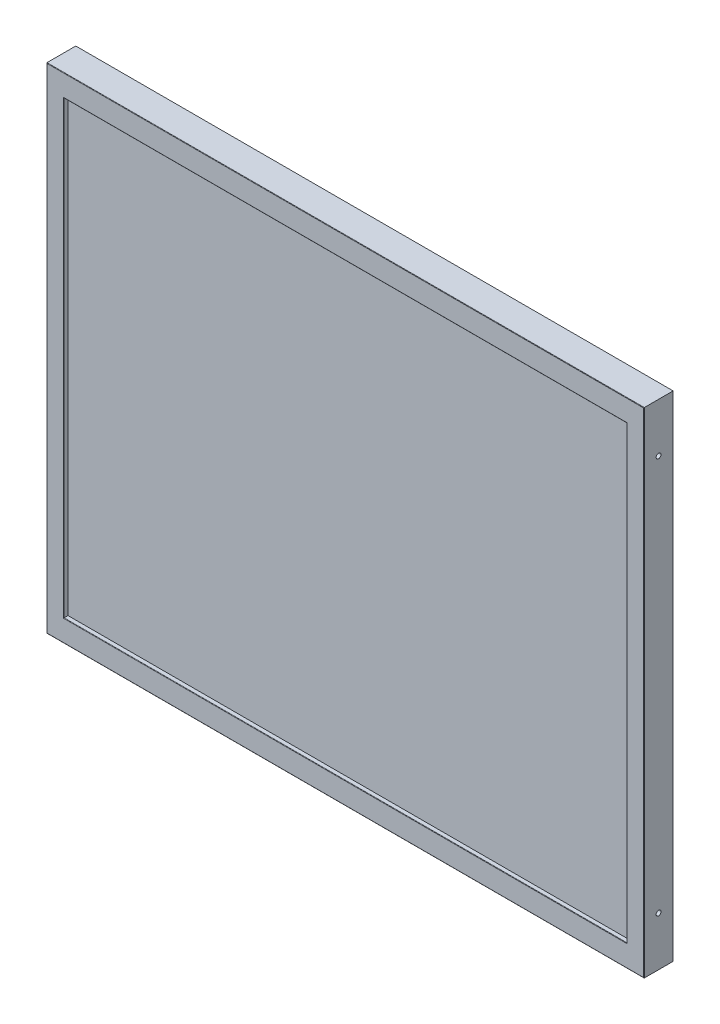
from build123d import *

# Parameters (mm, degrees)
SKETCH1_W           = 358.4999942
SKETCH1_H           = 296.4999912
BOSS_EXTRUDE1_DEPTH = 17.50000056
SKETCH2_W           = 337.90001
SKETCH2_H           = 270.2999928
CUT_EXTRUDE1_DEPTH  = 2.54
FILLET1_R           = 0.254
FILLET2_R           = 0.254
SKETCH3_R           = 1.4605
CUT_EXTRUDE2_DEPTH  = 5.08
CUT_EXTRUDE3_START  = -5.08
SKETCH4_R           = 1.4605
CUT_EXTRUDE3_DEPTH  = 5.08


with BuildPart() as part:
    # Sketch1 → Boss-Extrude1 (new body)
    with BuildSketch(Plane.XY):
        with Locations((179.2499971, 148.2499956)):
            Rectangle(SKETCH1_W, SKETCH1_H)
    extrude(amount=BOSS_EXTRUDE1_DEPTH)

    # Sketch2 → Cut-Extrude1 (cut)
    with BuildSketch(Plane.XY.offset(17.50000056)):
        with Locations((179.2499971, 148.2499956)):
            Rectangle(SKETCH2_W, SKETCH2_H)
    extrude(amount=-CUT_EXTRUDE1_DEPTH, mode=Mode.SUBTRACT)

    # Fillet1
    fillet1_edges = [part.edges().sort_by_distance(p)[0] for p in [
        (358.4999942, 148.2499956, 17.50000056),
        (179.2499971, 296.4999912, 17.50000056),
        (0, 148.2499956, 17.50000056),
        (179.2499971, 0, 17.50000056),
    ]]
    fillet(fillet1_edges, radius=FILLET1_R)

    # Fillet2
    fillet2_edges = [part.edges().sort_by_distance(p)[0] for p in [
        (348.2000021, 148.2499956, 14.96000056),
        (179.2499971, 13.0999992, 17.50000056),
        (10.2999921, 148.2499956, 17.50000056),
        (179.2499971, 283.399992, 17.50000056),
    ]]
    fillet(fillet2_edges, radius=FILLET2_R)

    # Sketch3 → Cut-Extrude2 (cut)
    with BuildSketch(Plane.ZY):
        with Locations((8.75000028, 267.0359912)):
            Circle(SKETCH3_R)
        with Locations((8.75000028, 29.464)):
            Circle(SKETCH3_R)
    extrude(amount=-CUT_EXTRUDE2_DEPTH, mode=Mode.SUBTRACT)

    # Sketch4 → Cut-Extrude3 (cut)
    with BuildSketch(Plane(origin=(358.4999942, 0, 0), x_dir=(0, 0, -1), z_dir=(1, 0, 0)).offset(CUT_EXTRUDE3_START)):
        with Locations((-8.75000028, 267.0359912)):
            Circle(SKETCH4_R)
        with Locations((-8.75000028, 29.464)):
            Circle(SKETCH4_R)
    extrude(amount=CUT_EXTRUDE3_DEPTH, mode=Mode.SUBTRACT)


solid = part.part
